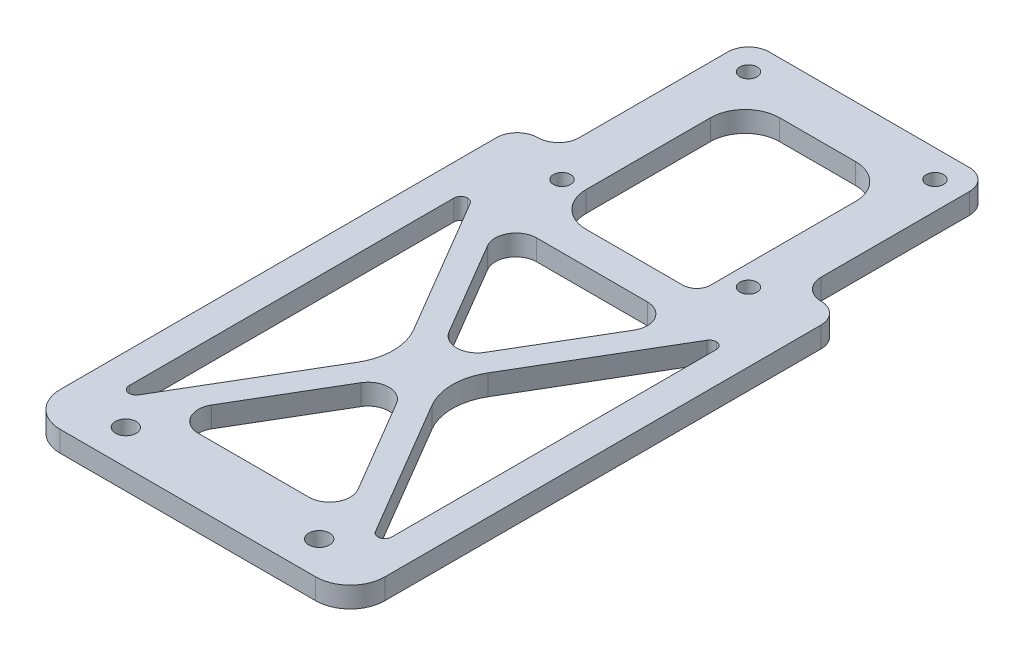
from build123d import *

# Parameters (mm, degrees)
SKETCH_1_W          = 47
SKETCH_1_H          = 106.16
SKETCH_1_W_2        = 10.5
SKETCH_1_H_2        = 10
EXTRUDE_1_DEPTH     = 3
SKETCH_4_R          = 1.5
SKETCH_4_W          = 47
SKETCH_4_H          = 5
CUT_EXTRUDE_2_DEPTH = 4
SKETCH_10_R         = 1.25
CUT_EXTRUDE_4_DEPTH = 10
SKETCH_16_W         = 17.5
SKETCH_16_H         = 2.5
CUT_EXTRUDE_5_DEPTH = 10
FILLET_1_R          = 3
CUT_EXTRUDE_7_DEPTH = 10
FILLET_2_R          = 1
FILLET_3_R          = 8
FILLET_4_R          = 3
FILLET_5_R          = 5
SKETCH_17_W         = 21
SKETCH_17_H         = 20
SKETCH_17_H_2       = 8
CUT_EXTRUDE_8_DEPTH = 10
FILLET_6_R          = 5
FILLET_7_R          = 2


# Some blends are built 0.0001 mm under size
with BuildPart() as part:
    # 草图1 → 凸台-拉伸1 (new body)
    with BuildSketch(Plane(origin=(0, 0, 0), x_dir=(1, 0, 0), z_dir=(0, 1, 0))):
        with Locations((0, -33.08)):
            Rectangle(SKETCH_1_W, SKETCH_1_H)
        with Locations((5.25, -13)):
            Rectangle(SKETCH_1_W_2, SKETCH_1_H_2, mode=Mode.SUBTRACT)
    extrude(amount=EXTRUDE_1_DEPTH)

    # 草图4 → 切除-拉伸2 (cut)
    with BuildSketch(Plane(origin=(0, 3, 0), x_dir=(1, 0, 0), z_dir=(0, 1, 0))):
        with Locations(Location((-14, -76.16, 0), (0, 0, 270))):
            Circle(SKETCH_4_R)
        with Locations(Location((14, -76.16, 0), (0, 0, 270))):
            Circle(SKETCH_4_R)
        with Locations((0, -83.66)):
            Rectangle(SKETCH_4_W, SKETCH_4_H)
    extrude(amount=-CUT_EXTRUDE_2_DEPTH, mode=Mode.SUBTRACT)

    # 草图10 → 切除-拉伸4 (cut)
    with BuildSketch(Plane(origin=(0, 3, 0), x_dir=(1, 0, 0), z_dir=(0, 1, 0))):
        with Locations(Location((13.5, 13.5, 0), (0, 0, 270))):
            Circle(SKETCH_10_R)
        with Locations(Location((13.5, -13.5, 0), (0, 0, 270))):
            Circle(SKETCH_10_R)
        with Locations(Location((-13.5, -13.5, 0), (0, 0, 270))):
            Circle(SKETCH_10_R)
        with Locations(Location((-13.5, 13.5, 0), (0, 0, 270))):
            Circle(SKETCH_10_R)
    extrude(amount=-CUT_EXTRUDE_4_DEPTH, mode=Mode.SUBTRACT)

    # 草图16 → 切除-拉伸5 (cut)
    with BuildSketch(Plane(origin=(0, 3, 0), x_dir=(1, 0, 0), z_dir=(0, 1, 0))):
        Polygon((-17.5, 17.5), (-17.5, 20), (-23.5, 20), (-23.5, -10), (-17.5, -10), align=None)
        Polygon((23.5, 20), (17.5, 20), (17.5, 17.5), (17.5, -10), (23.5, -10), align=None)
        with Locations((8.75, 18.75)):
            Rectangle(SKETCH_16_W, SKETCH_16_H)
        with Locations((-8.75, 18.75)):
            Rectangle(SKETCH_16_W, SKETCH_16_H)
    extrude(amount=-CUT_EXTRUDE_5_DEPTH, mode=Mode.SUBTRACT)

    # 圆角1
    fillet_1_edges = [part.edges().sort_by_distance(p)[0] for p in [
        (-17.5, 1.5, -17.5),
        (17.5, 1.5, -17.5),
        (23.5, 1.5, 10),
        (-23.5, 1.5, 10),
        (17.5, 1.5, 10),
        (-17.5, 1.5, 10),
    ]]
    fillet(fillet_1_edges, radius=FILLET_1_R - 0.0001)  # a hair under: the kernel refuses the full size

    # 草图9 → 切除-拉伸7 (cut)
    with BuildSketch(Plane(origin=(0, 3, 0), x_dir=(1, 0, 0), z_dir=(0, 1, 0))):
        Polygon((-3, -47.16), (-17.4375, -22.66), (-19, -22.66), (-19, -71.66), (-17.4375, -71.66), align=None)
        Polygon((0, -45.16), (13.258928571, -22.66), (-13.258928571, -22.66), align=None)
        Polygon((19, -22.66), (17.4375, -22.66), (3, -47.16), (17.4375, -71.66), (19, -71.66), align=None)
        Polygon((-13.258928571, -71.66), (13.258928571, -71.66), (0, -49.16), align=None)
    extrude(amount=-CUT_EXTRUDE_7_DEPTH, mode=Mode.SUBTRACT)

    # 圆角2
    # the kernel refuses this fillet: 1 mm, written as the material it adds along each edge
    with BuildSketch(Plane(origin=(-17.4375, 3, 71.66), x_dir=(-1, 0, 0), z_dir=(0, -1, 0)), Plane(origin=(17.4375, 3, 71.66), x_dir=(-0.507692307692314, 0, -0.8615384615384579), z_dir=(0, -1, 0)), Plane(origin=(17.4375, 3, 22.66), x_dir=(1, 0, 0), z_dir=(0, -1, 0)), Plane(origin=(-17.4375, 3, 22.66), x_dir=(0.5076923076923058, 0, 0.8615384615384627), z_dir=(0, -1, 0))) as fillet_2_piece_1:
        with BuildLine():
            CenterArc((FILLET_2_R * 0.571428571429, FILLET_2_R), FILLET_2_R, 210.510237406, 59.489762594)
            Line((-FILLET_2_R * 0.29010989011, FILLET_2_R * 0.492307692308), (0, 0))
            Line((0, 0), (FILLET_2_R * 0.571428571429, 0))
        make_face()
    extrude(amount=3)
    with BuildSketch(Plane(origin=(-19, 3, 71.66), x_dir=(0, 0, -1), z_dir=(0, -1, 0)), Plane(origin=(19, 3, 71.66), x_dir=(-1, 0, 0), z_dir=(0, -1, 0)), Plane(origin=(-19, 3, 22.66), x_dir=(1, 0, 0), z_dir=(0, -1, 0))) as fillet_2_piece_2:
        with BuildLine():
            CenterArc((FILLET_2_R, FILLET_2_R), FILLET_2_R, 180, 90)
            Line((0, FILLET_2_R), (0, 0))
            Line((0, 0), (FILLET_2_R, 0))
        make_face()
    extrude(amount=3)
    with BuildSketch(Plane(origin=(19, 3, 22.66), x_dir=(-1, 0, 0), z_dir=(0, -1, 0))) as fillet_2_piece_3:
        with BuildLine():
            CenterArc((FILLET_2_R, -FILLET_2_R), FILLET_2_R, 90, 90)
            Line((0, -FILLET_2_R), (0, 0))
            Line((0, 0), (FILLET_2_R, 0))
        make_face()
    extrude(amount=3)

    # 圆角3
    fillet_3_edges = [part.edges().sort_by_distance(p)[0] for p in [
        (3, 1.5, 47.16),
        (-3, 1.5, 47.16),
    ]]
    fillet(fillet_3_edges, radius=FILLET_3_R)

    # 圆角4
    fillet_4_edges = [part.edges().sort_by_distance(p)[0] for p in [
        (-13.258928571, 1.5, 22.66),
        (13.258928571, 1.5, 22.66),
        (0, 1.5, 45.16),
        (-13.258928571, 1.5, 71.66),
        (0, 1.5, 49.16),
        (13.258928571, 1.5, 71.66),
    ]]
    fillet(fillet_4_edges, radius=FILLET_4_R)

    # 圆角5
    fillet_5_edges = [part.edges().sort_by_distance(p)[0] for p in [
        (-23.5, 1.5, 81.16),
        (23.5, 1.5, 81.16),
    ]]
    fillet(fillet_5_edges, radius=FILLET_5_R)

    # 草图17 → 切除-拉伸8 (cut)
    with BuildSketch(Plane(origin=(0, 3, 0), x_dir=(1, 0, 0), z_dir=(0, 1, 0))):
        Rectangle(SKETCH_17_W, SKETCH_17_H)
        with Locations((0, -14)):
            Rectangle(SKETCH_17_W, SKETCH_17_H_2)
    extrude(amount=-CUT_EXTRUDE_8_DEPTH, mode=Mode.SUBTRACT)

    # 圆角6
    fillet_6_edges = [part.edges().sort_by_distance(p)[0] for p in [
        (-10.5, 1.5, 18),
        (-10.5, 1.5, -10),
        (10.5, 1.5, -10),
    ]]
    fillet(fillet_6_edges, radius=FILLET_6_R)

    # 圆角7
    fillet_7_edges = [part.edges().sort_by_distance(p)[0] for p in [
        (10.5, 1.5, 18),
    ]]
    fillet(fillet_7_edges, radius=FILLET_7_R)


solid = part.part
